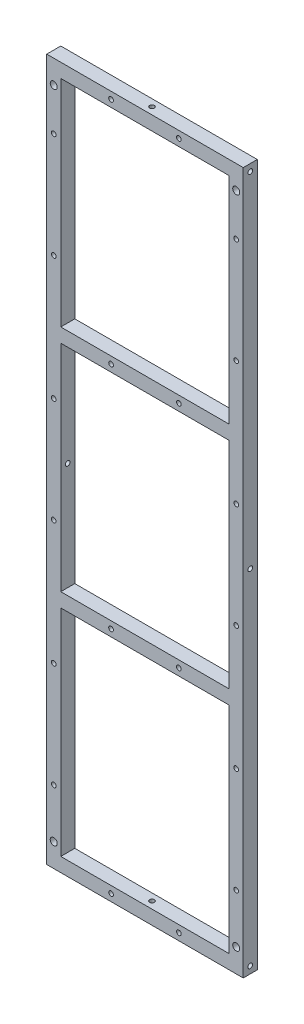
from build123d import *

# Parameters (mm, degrees)
SKETCH1_W            = 84
SKETCH1_H            = 300
SKETCH1_W_2          = 72
SKETCH1_H_2          = 92
BOSS_EXTRUDE1_DEPTH  = 6
SKETCH2_R            = 1
CUT_EXTRUDE1_DEPTH   = 10
SKETCH4_R            = 1
CUT_EXTRUDE3_DEPTH   = 10
SKETCH5_R            = 1
CUT_EXTRUDE4_DEPTH   = 10
SKETCH6_R            = 1.5
CUT_EXTRUDE5_DEPTH   = 10
LPATTERN1_COUNT      = 2
LPATTERN1_PITCH      = 78
LPATTERN1_COUNT_DIR2 = 2
LPATTERN1_PITCH_DIR2 = 280


with BuildPart() as part:
    # Sketch1 → Boss-Extrude1 (new body)
    with BuildSketch(Plane.XY):
        Rectangle(SKETCH1_W, SKETCH1_H)
        with Locations((0, 98)):
            Rectangle(SKETCH1_W_2, SKETCH1_H_2, mode=Mode.SUBTRACT)
        with Locations((0, -98)):
            Rectangle(SKETCH1_W_2, SKETCH1_H_2, mode=Mode.SUBTRACT)
        Rectangle(SKETCH1_W_2, SKETCH1_H_2, mode=Mode.SUBTRACT)
    extrude(amount=BOSS_EXTRUDE1_DEPTH)

    # Sketch2 → Cut-Extrude1 (cut)
    with BuildSketch(Plane(origin=(42, 0, 0), x_dir=(0, 0, -1), z_dir=(1, 0, 0))):
        with Locations((-3, 147)):
            Circle(SKETCH2_R)
        with Locations((-3, 0)):
            Circle(SKETCH2_R)
        with Locations((-3, -147)):
            Circle(SKETCH2_R)
        with Locations((-3, -294)):
            Circle(SKETCH2_R)
    cut_extrude1 = extrude(amount=-CUT_EXTRUDE1_DEPTH, mode=Mode.SUBTRACT)

    # Mirror1: Cut-Extrude1 across plane
    add(cut_extrude1.mirror(Plane(origin=(0, 0, 0), x_dir=(0, 0, 1), z_dir=(1, 0, 0))), mode=Mode.SUBTRACT)

    # Sketch4 → Cut-Extrude3 (cut)
    with BuildSketch(Plane.XY.offset(6)):
        with Locations((-14.5, 147)):
            Circle(SKETCH4_R)
        with Locations((14.5, 147)):
            Circle(SKETCH4_R)
        with Locations((-39, 122)):
            Circle(SKETCH4_R)
        with Locations((-14.5, 49)):
            Circle(SKETCH4_R)
        with Locations((14.5, 49)):
            Circle(SKETCH4_R)
        with Locations((-14.5, -49)):
            Circle(SKETCH4_R)
        with Locations((14.5, -49)):
            Circle(SKETCH4_R)
        with Locations((-14.5, -147)):
            Circle(SKETCH4_R)
        with Locations((14.5, -147)):
            Circle(SKETCH4_R)
        with Locations((39, 122)):
            Circle(SKETCH4_R)
        with Locations((39, 77)):
            Circle(SKETCH4_R)
        with Locations((-39, 77)):
            Circle(SKETCH4_R)
        with Locations((-39, 24)):
            Circle(SKETCH4_R)
        with Locations((39, 24)):
            Circle(SKETCH4_R)
        with Locations((39, -21)):
            Circle(SKETCH4_R)
        with Locations((-39, -21)):
            Circle(SKETCH4_R)
        with Locations((-39, -74)):
            Circle(SKETCH4_R)
        with Locations((39, -74)):
            Circle(SKETCH4_R)
        with Locations((39, -119)):
            Circle(SKETCH4_R)
        with Locations((-39, -119)):
            Circle(SKETCH4_R)
    extrude(amount=-CUT_EXTRUDE3_DEPTH, mode=Mode.SUBTRACT)

    # Sketch5 → Cut-Extrude4 (cut)
    with BuildSketch(Plane(origin=(0, 150, 0), x_dir=(1, 0, 0), z_dir=(0, 1, 0))):
        with Locations((0, -3)):
            Circle(SKETCH5_R)
    cut_extrude4 = extrude(amount=-CUT_EXTRUDE4_DEPTH, mode=Mode.SUBTRACT)

    # Mirror2: Cut-Extrude4 across plane
    add(cut_extrude4.mirror(Plane.ZX), mode=Mode.SUBTRACT)

    # Sketch6 → Cut-Extrude5 (cut)
    with BuildSketch(Plane.XY.offset(6)):
        with Locations((-39, 140)):
            Circle(SKETCH6_R)
    cut_extrude5 = extrude(amount=-CUT_EXTRUDE5_DEPTH, mode=Mode.SUBTRACT)

    # LPattern1: Cut-Extrude5 2 × 2
    with Locations(*[(i * LPATTERN1_PITCH, -j * LPATTERN1_PITCH_DIR2, 0) for i in range(LPATTERN1_COUNT) for j in range(LPATTERN1_COUNT_DIR2) if (i, j) != (0, 0)]):
        add(cut_extrude5, mode=Mode.SUBTRACT)


solid = part.part
